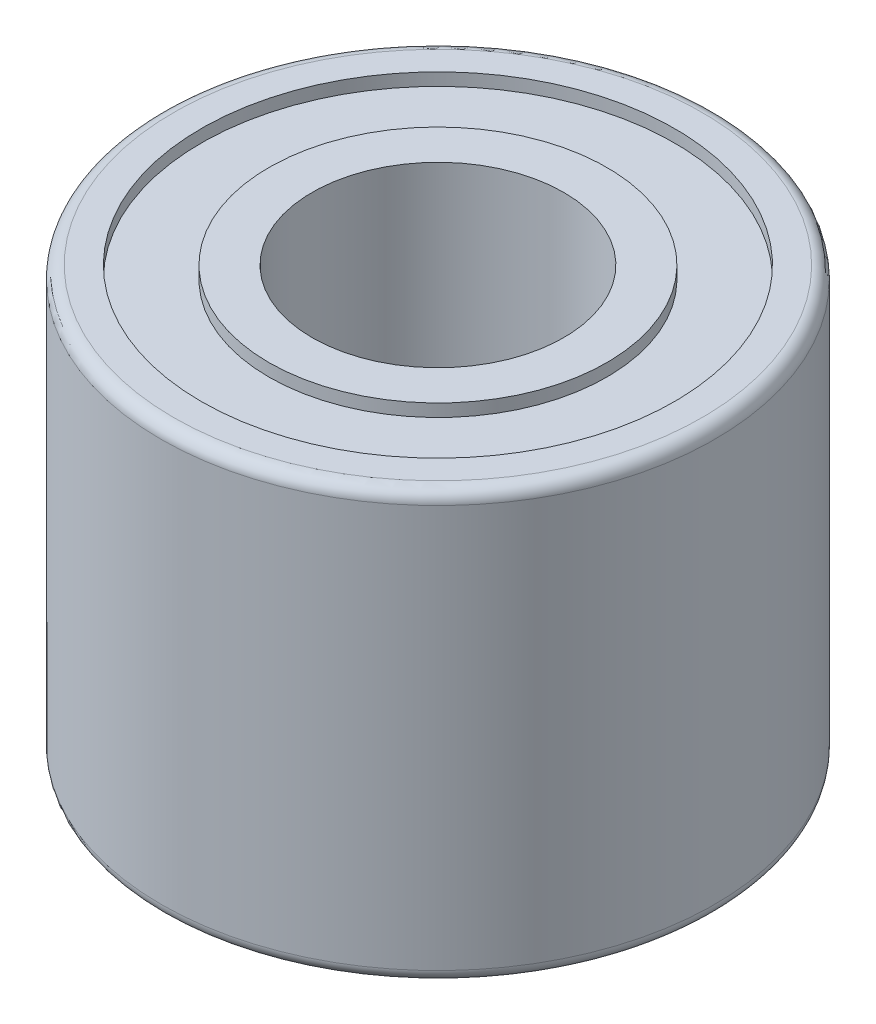
from build123d import *

# Parameters (mm, degrees)
SKETCH1_R           = 6.715
SKETCH1_R_2         = 5
BOSS_EXTRUDE1_DEPTH = 17
SKETCH4_R           = 9.4
BOSS_EXTRUDE2_DEPTH = 8
SKETCH7_R           = 11
SKETCH7_R_2         = 9.4
BOSS_EXTRUDE3_DEPTH = 17
SKETCH8_R           = 5
CUT_EXTRUDE1_DEPTH  = 17
FILLET1_R           = 0.5


with BuildPart() as part:
    # Sketch1 → Boss-Extrude1 (new body)
    with BuildSketch(Plane(origin=(0, 0, 0), x_dir=(1, 0, 0), z_dir=(0, 1, 0))):
        Circle(SKETCH1_R)
        Circle(SKETCH1_R_2, mode=Mode.SUBTRACT)
    extrude(amount=BOSS_EXTRUDE1_DEPTH)

    # Sketch4 → Boss-Extrude2 (add, symmetric)
    with BuildSketch(Plane(origin=(0, 8.5, 0), x_dir=(1, 0, 0), z_dir=(0, 1, 0))):
        Circle(SKETCH4_R)
    extrude(amount=BOSS_EXTRUDE2_DEPTH, both=True)

    # Sketch7 → Boss-Extrude3 (add)
    with BuildSketch(Plane(origin=(0, 17, 0), x_dir=(1, 0, 0), z_dir=(0, 1, 0))):
        Circle(SKETCH7_R)
        Circle(SKETCH7_R_2, mode=Mode.SUBTRACT)
    extrude(amount=-BOSS_EXTRUDE3_DEPTH)

    # Sketch8 → Cut-Extrude1 (cut)
    with BuildSketch(Plane.XZ.offset(-0.5)):
        Circle(SKETCH8_R)
    extrude(amount=-CUT_EXTRUDE1_DEPTH, mode=Mode.SUBTRACT)

    # Fillet1
    fillet1_edges = [part.edges().sort_by_distance(p)[0] for p in [
        (-11, 0, 0),
        (-11, 17, 0),
    ]]
    fillet(fillet1_edges, radius=FILLET1_R)


solid = part.part
